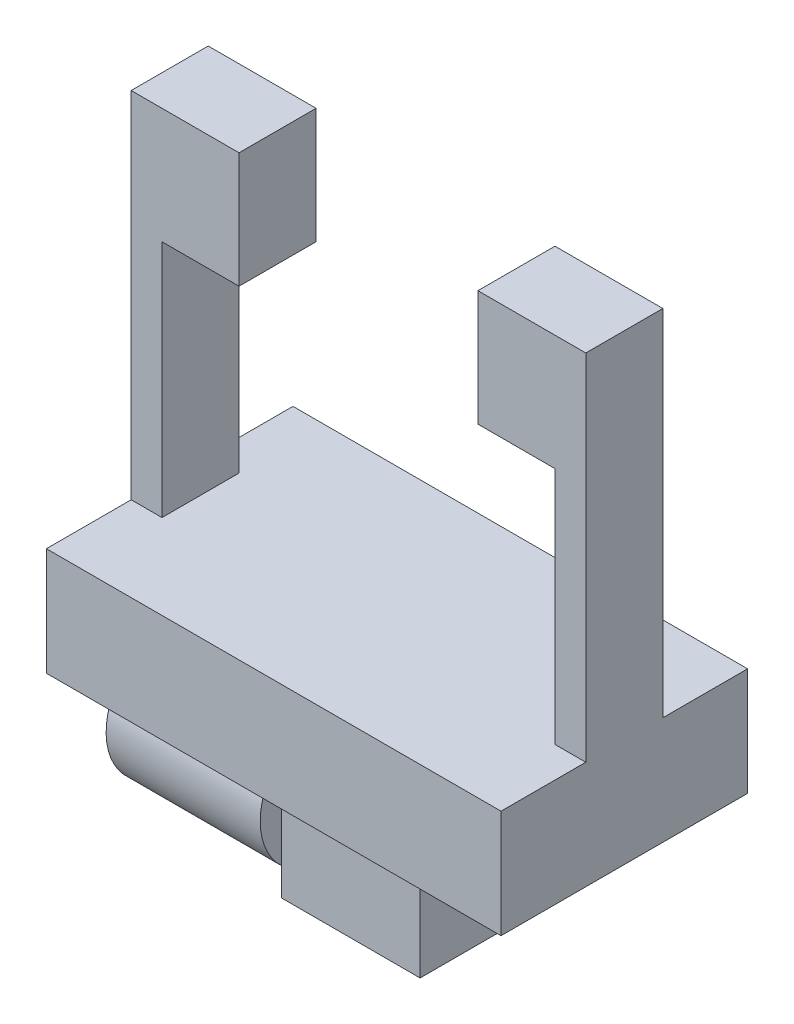
from build123d import *

# Parameters (mm, degrees)
SKETCH1_W           = 74.93
SKETCH1_H           = 17.78
BOSS_EXTRUDE1_DEPTH = 20.32
SKETCH2_W           = 5.08
SKETCH2_H           = 39.37
BOSS_EXTRUDE2_DEPTH = 6.35
SKETCH3_W           = 17.78
SKETCH3_H           = 19.05
BOSS_EXTRUDE3_DEPTH = 6.35
SKETCH5_W           = 22.86
SKETCH5_H           = 25.4
BOSS_EXTRUDE4_DEPTH = 7.62
SKETCH6_R           = 11.1125
BOSS_EXTRUDE5_DEPTH = 25.4


with BuildPart() as part:
    # Sketch1 → Boss-Extrude1 (new, symmetric)
    with BuildSketch(Plane.XY):
        Rectangle(SKETCH1_W, SKETCH1_H)
    extrude(amount=BOSS_EXTRUDE1_DEPTH, both=True)

    # Sketch2 → Boss-Extrude2 (add, symmetric)
    with BuildSketch(Plane.XY):
        with Locations((-34.925, 28.575)):
            Rectangle(SKETCH2_W, SKETCH2_H)
        with Locations((34.925, 28.575)):
            Rectangle(SKETCH2_W, SKETCH2_H)
    extrude(amount=BOSS_EXTRUDE2_DEPTH, both=True)

    # Sketch3 → Boss-Extrude3 (add, symmetric)
    with BuildSketch(Plane.XY):
        with Locations((28.575, 57.785)):
            Rectangle(SKETCH3_W, SKETCH3_H)
        with Locations((-28.575, 57.785)):
            Rectangle(SKETCH3_W, SKETCH3_H)
    extrude(amount=BOSS_EXTRUDE3_DEPTH, both=True)

    # Sketch5 → Boss-Extrude4 (add, symmetric)
    with BuildSketch(Plane.XY):
        with Locations((0, -21.59)):
            Rectangle(SKETCH5_W, SKETCH5_H)
    extrude(amount=BOSS_EXTRUDE4_DEPTH, both=True)

    # Sketch6 → Boss-Extrude5 (add)
    with BuildSketch(Plane.ZY.offset(11.43)):
        with Locations((0, -21.59)):
            Circle(SKETCH6_R)
    extrude(amount=BOSS_EXTRUDE5_DEPTH)


solid = part.part
